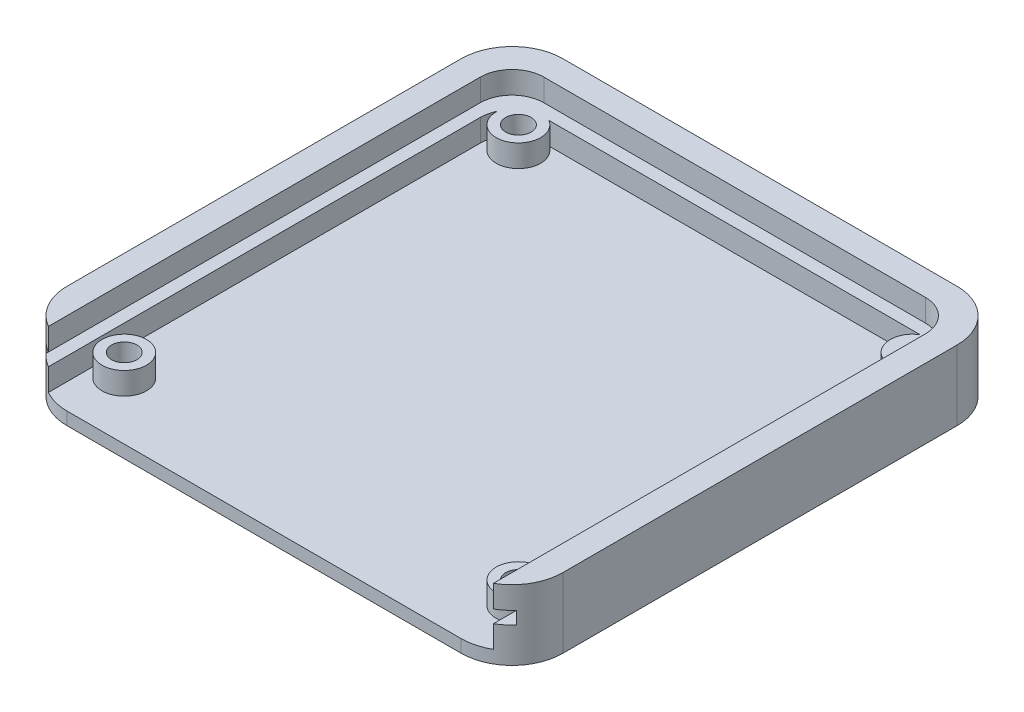
from build123d import *

# Parameters (mm, degrees)
BOSS_EXTRUDE1_DEPTH = 11
SKETCH2_4_W         = 74
SKETCH2_4_H         = 76
BOSS_EXTRUDE2_DEPTH = 2
SKETCH3_W           = 2
SKETCH3_H           = 3.5
BOSS_EXTRUDE3_DEPTH = 76
LPATTERN1_COUNT     = 2
LPATTERN1_PITCH     = 72
SKETCH4_W           = 2
SKETCH4_H           = 3.5
BOSS_EXTRUDE5_DEPTH = 71
FILLET2_R           = 5
SKETCH7_R           = 2
SKETCH7_R_2         = 3.5
BOSS_EXTRUDE9_DEPTH = 3.5
FILLET10_R          = 8


with BuildPart() as part:
    # Sketch2 → Boss-Extrude1 (new body)
    with BuildSketch(Plane(origin=(0, 0, 0), x_dir=(1, 0, 0), z_dir=(0, 1, 0))):
        Polygon((-78, 0), (-76, 0), (-76, 76), (-2, 76), (-2, 0), (0, 0), (0, 78), (-78, 78), align=None)
    extrude(amount=BOSS_EXTRUDE1_DEPTH)

    # Sketch2<4> → Boss-Extrude2 (add)
    with BuildSketch(Plane(origin=(0, 0, 0), x_dir=(1, 0, 0), z_dir=(0, 1, 0))):
        with Locations((-39, 38)):
            Rectangle(SKETCH2_4_W, SKETCH2_4_H)
    extrude(amount=BOSS_EXTRUDE2_DEPTH)

    # Sketch3 → Boss-Extrude3 (add)
    with BuildSketch(Plane.XY):
        with Locations((-75, 9.25)):
            Rectangle(SKETCH3_W, SKETCH3_H)
        with Locations((-75, 3.75)):
            Rectangle(SKETCH3_W, SKETCH3_H)
    boss_extrude3 = extrude(amount=-BOSS_EXTRUDE3_DEPTH)

    # LPattern1: Boss-Extrude3 ×2
    with Locations(*[(i * LPATTERN1_PITCH, 0, 0) for i in range(1, LPATTERN1_COUNT)]):
        add(boss_extrude3)

    # Sketch4 → Boss-Extrude5 (add)
    with BuildSketch(Plane(origin=(-74, 0, 0), x_dir=(0, 0, -1), z_dir=(1, 0, 0))):
        with Locations((75, 9.25)):
            Rectangle(SKETCH4_W, SKETCH4_H)
        with Locations((75, 3.75)):
            Rectangle(SKETCH4_W, SKETCH4_H)
    extrude(amount=BOSS_EXTRUDE5_DEPTH)

    # Fillet2
    fillet2_edges = [part.edges().sort_by_distance(p)[0] for p in [
        (-2, 6.5, -76),
        (-4, 9.25, -74),
        (-4, 3.75, -74),
        (-74, 3.75, -74),
        (-74, 9.25, -74),
        (-76, 6.5, -76),
    ]]
    fillet(fillet2_edges, radius=FILLET2_R)

    # Sketch7 → Boss-Extrude9 (add)
    # profile 1 of 4: a face of its own
    with BuildSketch(Plane(origin=(0, 2, 0), x_dir=(1, 0, 0), z_dir=(0, 1, 0))):
        with BuildLine():
            ThreePointArc((-73.494834554, 71.190082723), (-68.35997725, 67.908022416), (-68.197224362, 74))
            Line((-68.197224362, 74), (-69, 74))
            ThreePointArc((-69, 74), (-71.650432642, 73.239717775), (-73.494834554, 71.190082723))
        make_face()
        with Locations((-70, 71)):
            Circle(SKETCH7_R, mode=Mode.SUBTRACT)
    # profile 2 of 4: a face of its own
    with BuildSketch(Plane(origin=(0, 2, 0), x_dir=(1, 0, 0), z_dir=(0, 1, 0))):
        with Locations((-8, 71)):
            Circle(SKETCH7_R_2)
    # profile 3 of 4: a face of its own
    with BuildSketch(Plane(origin=(0, 2, 0), x_dir=(1, 0, 0), z_dir=(0, 1, 0))):
        with Locations((-8, 9)):
            Circle(SKETCH7_R_2)
        with Locations((-8, 9)):
            Circle(SKETCH7_R, mode=Mode.SUBTRACT)
    # profile 4 of 4: a face of its own
    with BuildSketch(Plane(origin=(0, 2, 0), x_dir=(1, 0, 0), z_dir=(0, 1, 0))):
        with Locations((-70, 9)):
            Circle(SKETCH7_R_2)
        with Locations((-70, 9)):
            Circle(SKETCH7_R, mode=Mode.SUBTRACT)
    extrude(amount=BOSS_EXTRUDE9_DEPTH)

    # Fillet10
    fillet10_edges = [part.edges().sort_by_distance(p)[0] for p in [
        (-78, 5.5, 0),
        (0, 5.5, 0),
        (0, 5.5, -78),
        (-78, 5.5, -78),
    ]]
    fillet(fillet10_edges, radius=FILLET10_R)


solid = part.part
